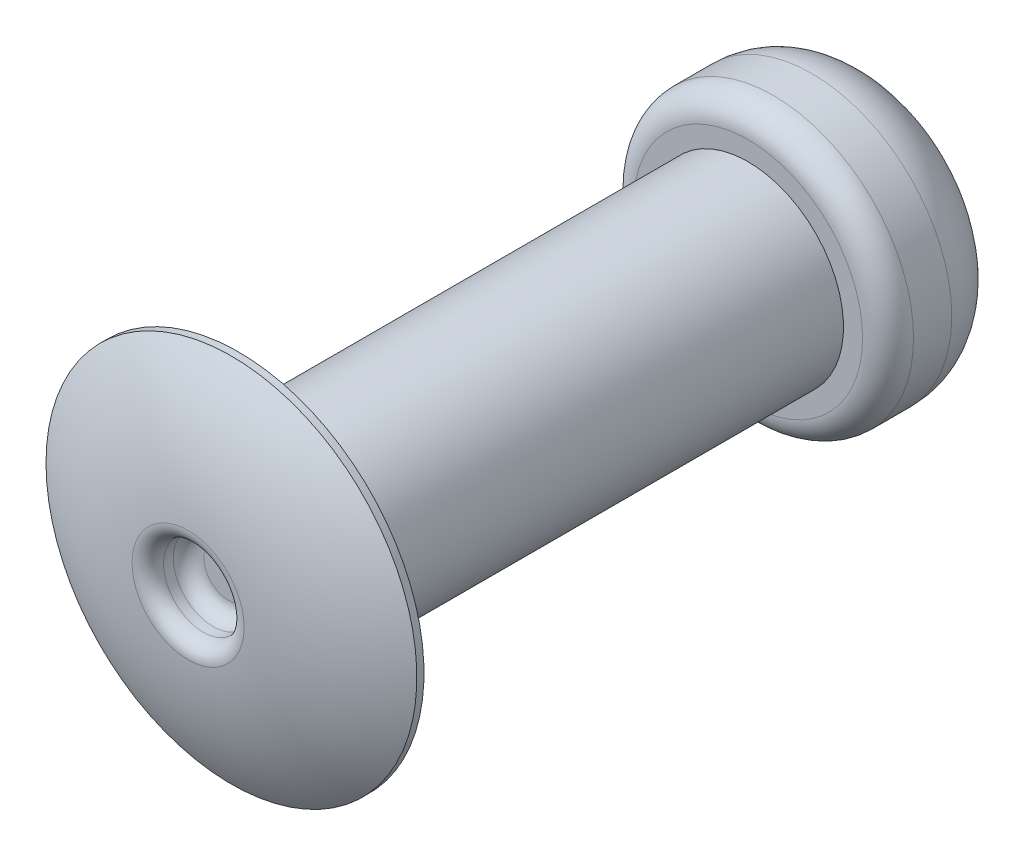
from build123d import *
from OCP.BRepFilletAPI import BRepFilletAPI_MakeFillet

# Parameters (mm, degrees)
SKETCH4_R          = 0.9921875
CUT_EXTRUDE1_DEPTH = 1.016
CUT_EXTRUDE2_START = -2.54
SKETCH3_R          = 0.9921875
CUT_EXTRUDE2_DEPTH = 2.54
FILLET1_R1         = 0.635
FILLET1_R2         = 1.5875
FILLET1_R3         = 0.381


with BuildPart() as part:
    # Sketch2 → Revolve1 (revolve)
    with BuildSketch(Plane(origin=(0, 0, 0), x_dir=(0, 0, -1), z_dir=(1, 0, 0))):
        with BuildLine():
            Line((-1.27, 0.9921875), (-1.27, 0))
            Line((-1.27, 0), (12.7, 0))
            Line((12.7, 0), (15.875, 0))
            Line((15.875, 0), (15.875, 3.4925))
            Line((15.875, 3.4925), (12.7, 3.4925))
            Line((12.7, 3.4925), (12.7, 2.38125))
            Line((12.7, 2.38125), (0, 2.38125))
            Line((0, 2.38125), (0, 4.6228))
            Line((0, 4.6228), (-0.1778, 4.6228))
            ThreePointArc((-0.1778, 4.6228), (-0.991036966, 2.887856773), (-1.27, 0.9921875))
        make_face()
    revolve(axis=Axis((0, 0, 7.600580616), (0, 0, 1)))

    # Sketch4 → Cut-Extrude1 (cut)
    with BuildSketch(Plane.XY.offset(1.27)):
        Circle(SKETCH4_R)
    extrude(amount=-CUT_EXTRUDE1_DEPTH, mode=Mode.SUBTRACT)

    # Sketch3 → Cut-Extrude2 (cut)
    with BuildSketch(Plane(origin=(0, 0, -15.875), x_dir=(-1, 0, 0), z_dir=(0, 0, -1)).offset(CUT_EXTRUDE2_START)):
        Circle(SKETCH3_R)
    extrude(amount=CUT_EXTRUDE2_DEPTH, mode=Mode.SUBTRACT)

    # Fillet1: one fillet with a radius per group of edges: ONE call of the kernel's fillet builder (fillet() takes one radius for all edges)
    fillet1_edges_1 = [part.edges().sort_by_distance(p)[0] for p in [
        (0, -3.4925, -12.7),
    ]]
    fillet1_edges_2 = [part.edges().sort_by_distance(p)[0] for p in [
        (0, -3.4925, -15.875),
    ]]
    fillet1_edges_3 = [part.edges().sort_by_distance(p)[0] for p in [
        (0, -2.38125, 0),
        (-0.701582509, -0.701582509, 1.27),
        (-0.9921875, 0, 0.254),
    ]]
    fillet1 = BRepFilletAPI_MakeFillet(part.part.solid().wrapped)
    for e in fillet1_edges_1:
        fillet1.Add(FILLET1_R1, e.wrapped)
    for e in fillet1_edges_2:
        fillet1.Add(FILLET1_R2, e.wrapped)
    for e in fillet1_edges_3:
        fillet1.Add(FILLET1_R3, e.wrapped)
    add(Compound.cast(fillet1.Shape()), mode=Mode.REPLACE)


solid = part.part
